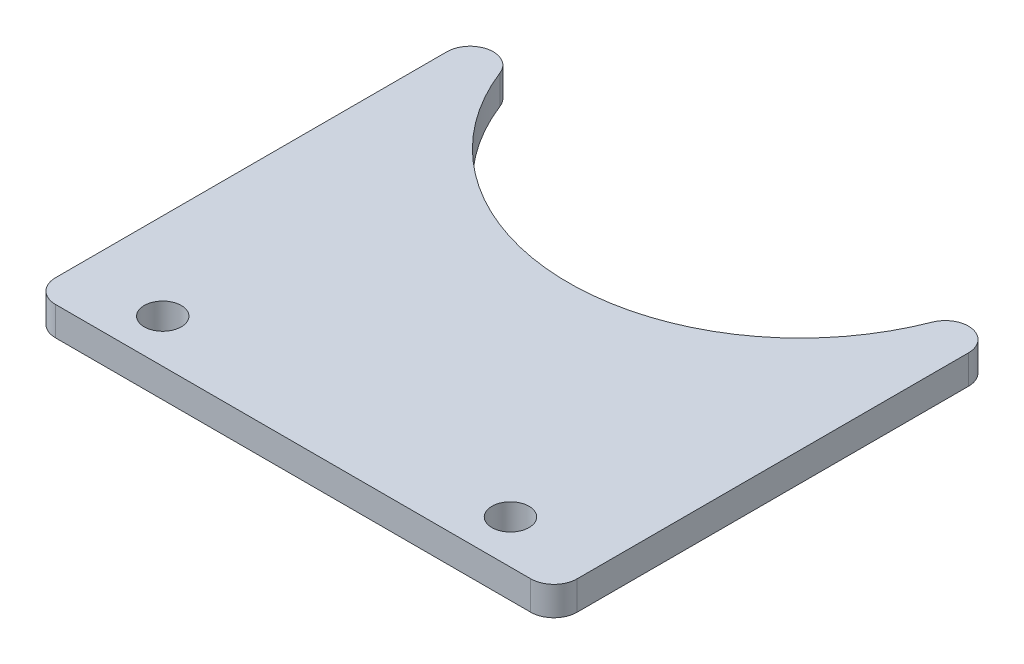
from build123d import *

# Parameters (mm, degrees)
SKETCH1_W           = 57.15
SKETCH1_H           = 60.325
BOSS_EXTRUDE1_DEPTH = 3.175
SKETCH2_R           = 2.032
CUT_EXTRUDE1_DEPTH  = 42.669985076
CUT_EXTRUDE2_DEPTH  = 42.669985076
FILLET1_R           = 2.54
FILLET2_R           = 2.54


with BuildPart() as part:
    # Sketch1 → Boss-Extrude1 (new body)
    with BuildSketch(Plane(origin=(0, 0, 0), x_dir=(1, 0, 0), z_dir=(0, 1, 0))):
        Rectangle(SKETCH1_W, SKETCH1_H)
    extrude(amount=BOSS_EXTRUDE1_DEPTH)

    # Sketch2 → Cut-Extrude1 (cut, through all)
    with BuildSketch(Plane(origin=(0, 0, 0), x_dir=(-1, 0, 0), z_dir=(0, -1, 0))):
        with Locations((-19.05, -25.4)):
            Circle(SKETCH2_R)
        with Locations((19.05, -25.4)):
            Circle(SKETCH2_R)
    extrude(amount=-CUT_EXTRUDE1_DEPTH, mode=Mode.SUBTRACT)

    # Sketch3 → Cut-Extrude2 (cut, through all)
    with BuildSketch(Plane.XZ):
        with BuildLine():
            Line((-23.975532391, -17.013472319), (-28.575, -30.1625))
            Line((-28.575, -30.1625), (28.575, -30.1625))
            Line((28.575, -30.1625), (23.975532391, -17.013472319))
            ThreePointArc((23.975532391, -17.013472319), (0, 0), (-23.975532391, -17.013472319))
        make_face()
    extrude(amount=-CUT_EXTRUDE2_DEPTH, mode=Mode.SUBTRACT)

    # Fillet1
    fillet1_edges = [part.edges().sort_by_distance(p)[0] for p in [
        (-28.575, 1.5875, 30.1625),
        (28.575, 1.5875, 30.1625),
    ]]
    fillet(fillet1_edges, radius=FILLET1_R)

    # Fillet2
    fillet2_edges = [part.edges().sort_by_distance(p)[0] for p in [
        (28.575, 1.5875, -30.1625),
        (-28.575, 1.5875, -30.1625),
    ]]
    fillet(fillet2_edges, radius=FILLET2_R)


solid = part.part
